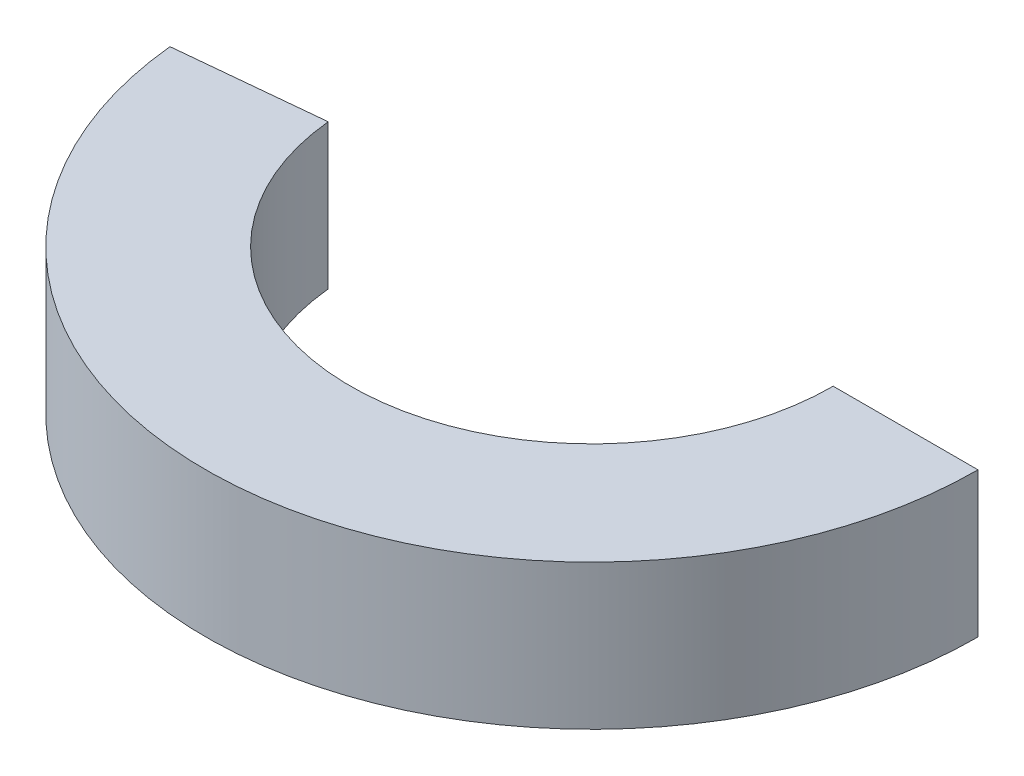
from build123d import *

# Parameters (mm, degrees)
BOSS_EXTRUDE1_DEPTH = 15


with BuildPart() as part:
    # Sketch1 → Boss-Extrude1 (new body)
    with BuildSketch(Plane(origin=(0, 0, 0), x_dir=(1, 0, 0), z_dir=(0, 1, 0))):
        with BuildLine():
            Line((-24.881535055, -2.430887348), (-39.810456088, -3.889419757))
            ThreePointArc((-39.810456088, -3.889419757), (1.94701778, -39.952585921), (40, 0))
            Line((40, 0), (25, 0))
            ThreePointArc((25, 0), (1.216886112, -24.970366201), (-24.881535055, -2.430887348))
        make_face()
    extrude(amount=BOSS_EXTRUDE1_DEPTH)


solid = part.part
